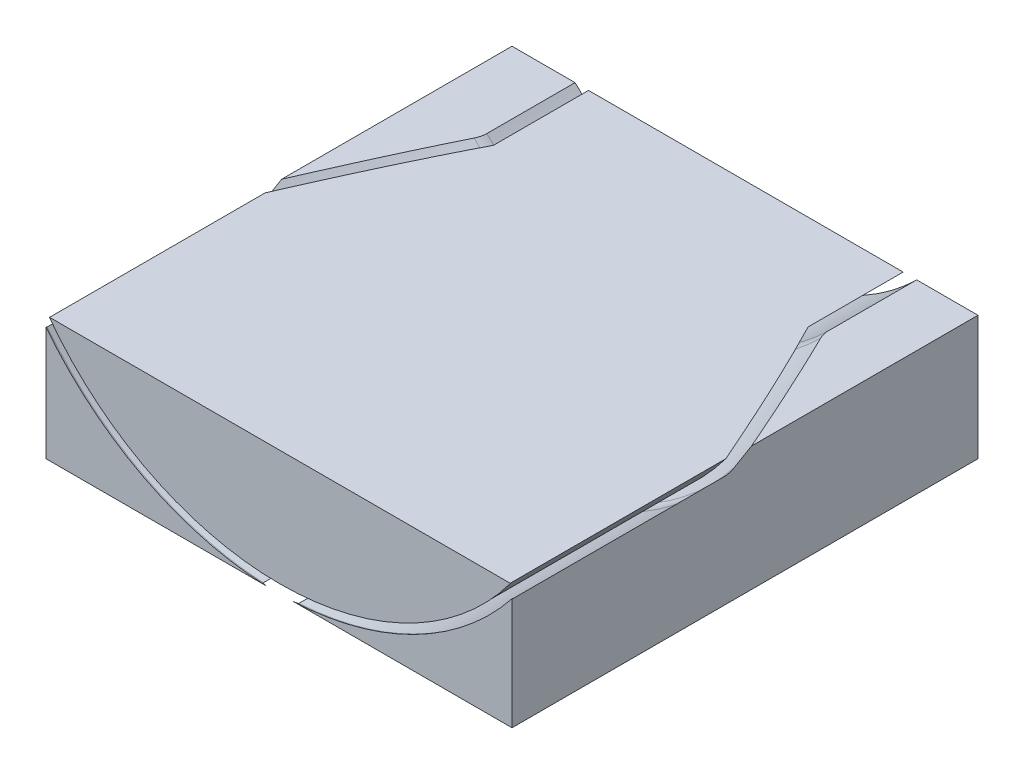
from build123d import *

# Parameters (mm, degrees)
ESQUISSE1_W        = 150
ESQUISSE1_H        = 40
BOSS_EXTRU_1_DEPTH = 150


# Read off the part's stored shape, not the designer's step: Empreinte2
with BuildPart() as part:
    # Esquisse1 → Boss.-Extru.1 (new body)
    with BuildSketch(Plane.XY):
        with Locations((75, 20)):
            Rectangle(ESQUISSE1_W, ESQUISSE1_H)
    extrude(amount=BOSS_EXTRU_1_DEPTH)

    # Empreinte2 outline → Empreinte2 (revolve, cut)
    with BuildSketch(Plane(origin=(75.277152303, 95.327729933, 0), x_dir=(1, 0, 0), z_dir=(0, -1, 0))):
        with BuildLine():
            ThreePointArc((94.938583563, 78.492216781), (95.358646855, 80.120286106), (95.5, 81.79572103))
            Line((95.5, 81.79572103), (95.5, 149.606100929))
            ThreePointArc((95.5, 149.606100929), (95.479579783, 149.807156762), (95.419153104, 150.000001387))
            Line((95.419153104, 150.000001387), (92.580846301, 150))
            ThreePointArc((92.580846301, 150), (92.520420065, 149.807156022), (92.5, 149.606100929))
            Line((92.5, 149.606100929), (92.5, 80.606100929))
            Line((92.5, 80.606100929), (74.999999885, 30.6061006))
            Line((74.999999885, 30.6061006), (75, 0))
            Line((75, 0), (78, 0))
            Line((78, 0), (78, 28.396806457))
            ThreePointArc((78, 28.396806457), (78.141353151, 30.072241418), (78.561416462, 31.700310776))
            Line((78.561416462, 31.700310776), (94.938583563, 78.492216781))
        make_face()
    revolve(axis=Axis((75.277152303, 95.327729933, 0), (0, 0, 1)), mode=Mode.SUBTRACT)


solid = part.part
